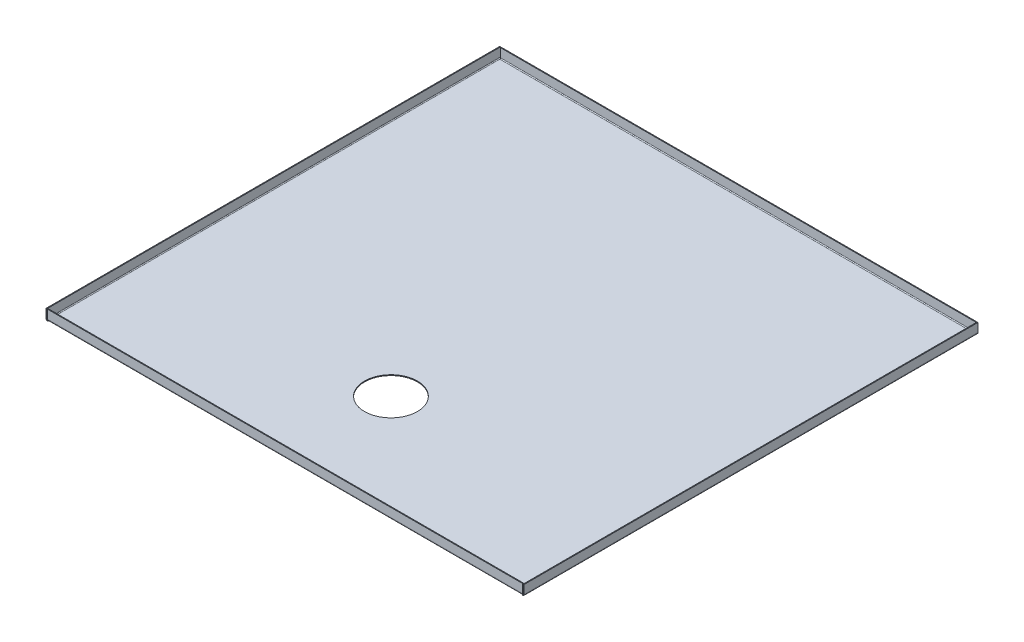
from build123d import *

# Parameters (mm, degrees)
BASE_FLANGE1_DEPTH             = 1096
EDGE_FLANGE1_STRIP_W           = 12
EDGE_FLANGE1_STRIP_H           = 2
EDGE_FLANGE1_STRIP_CUT_DEPTH   = 1147
EDGE_FLANGE1_STRIP_2_W         = 12
EDGE_FLANGE1_STRIP_2_H         = 2
EDGE_FLANGE1_STRIP_CUT_2_DEPTH = 1147
EDGE_FLANGE1_DEPTH             = 1147
EDGE_FLANGE1_BEND_DEPTH        = 1147
SKETCH12_R                     = 63.920888045
CUT_EXTRUDE1_DEPTH             = 10


# Sheet-metal steps are written as plain solids
with BuildPart() as part:
    # Sketch1 → Base-Flange1 (new body)
    with BuildSketch(Plane.XY):
        with BuildLine():
            Line((0, 25), (0, 4))
            ThreePointArc((0, 4), (1.171572875, 1.171572875), (4, 0))
            Line((4, 0), (1151, 0))
            ThreePointArc((1151, 0), (1153.828427125, 1.171572875), (1155, 4))
            Line((1155, 4), (1155, 25))
            Line((1155, 25), (1153, 25))
            Line((1153, 25), (1153, 4))
            ThreePointArc((1153, 4), (1152.414213562, 2.585786438), (1151, 2))
            Line((1151, 2), (4, 2))
            ThreePointArc((4, 2), (2.585786438, 2.585786438), (2, 4))
            Line((2, 4), (2, 25))
            Line((2, 25), (0, 25))
        make_face()
    extrude(amount=BASE_FLANGE1_DEPTH)

    # Edge-Flange1 strip (across the edge) → Edge-Flange1 strip cut (cut)
    with BuildSketch(Plane(origin=(4, 2, 1096), x_dir=(0, 0, -1), z_dir=(1, 0, 0))):
        with Locations((-2, -1)):
            Rectangle(EDGE_FLANGE1_STRIP_W, EDGE_FLANGE1_STRIP_H)
    extrude(amount=EDGE_FLANGE1_STRIP_CUT_DEPTH, mode=Mode.SUBTRACT)

    # Edge-Flange1 strip 2 (across the edge) → Edge-Flange1 strip cut 2 (cut)
    with BuildSketch(Plane(origin=(1151, 2, 0), x_dir=(0, 0, 1), z_dir=(-1, 0, 0))):
        with Locations((-2, -1)):
            Rectangle(EDGE_FLANGE1_STRIP_2_W, EDGE_FLANGE1_STRIP_2_H)
    extrude(amount=EDGE_FLANGE1_STRIP_CUT_2_DEPTH, mode=Mode.SUBTRACT)

    # Edge-Flange1 section (across the edge) → Edge-Flange1 (add)
    with BuildSketch(Plane(origin=(4, 2, 1096), x_dir=(0, 0, -1), z_dir=(1, 0, 0))):
        with BuildLine():
            Line((0, 2), (0, 23))
            Line((0, 23), (2, 23))
            Line((2, 23), (2, 2))
            ThreePointArc((2, 2), (2.585786438, 0.585786438), (4, 0))
            Line((4, 0), (4, -2))
            ThreePointArc((4, -2), (1.171572875, -0.828427125), (0, 2))
        make_face()
    extrude(amount=EDGE_FLANGE1_DEPTH)

    # Edge-Flange1 section 2 (across the edge) → Edge-Flange1 bend (add)
    with BuildSketch(Plane(origin=(1151, 2, 0), x_dir=(0, 0, 1), z_dir=(-1, 0, 0))):
        with BuildLine():
            Line((0, 2), (0, 23))
            Line((0, 23), (2, 23))
            Line((2, 23), (2, 2))
            ThreePointArc((2, 2), (2.585786438, 0.585786438), (4, 0))
            Line((4, 0), (4, -2))
            ThreePointArc((4, -2), (1.171572875, -0.828427125), (0, 2))
        make_face()
    extrude(amount=EDGE_FLANGE1_BEND_DEPTH)

    # Sketch12 → Cut-Extrude1 (cut)
    with BuildSketch(Plane(origin=(0, 2, 0), x_dir=(1, 0, 0), z_dir=(0, 1, 0))):
        with Locations(Location((577.5, -840.335133885, 0), (0, 0, 270))):
            Circle(SKETCH12_R)
    extrude(amount=-CUT_EXTRUDE1_DEPTH, mode=Mode.SUBTRACT)


solid = part.part
